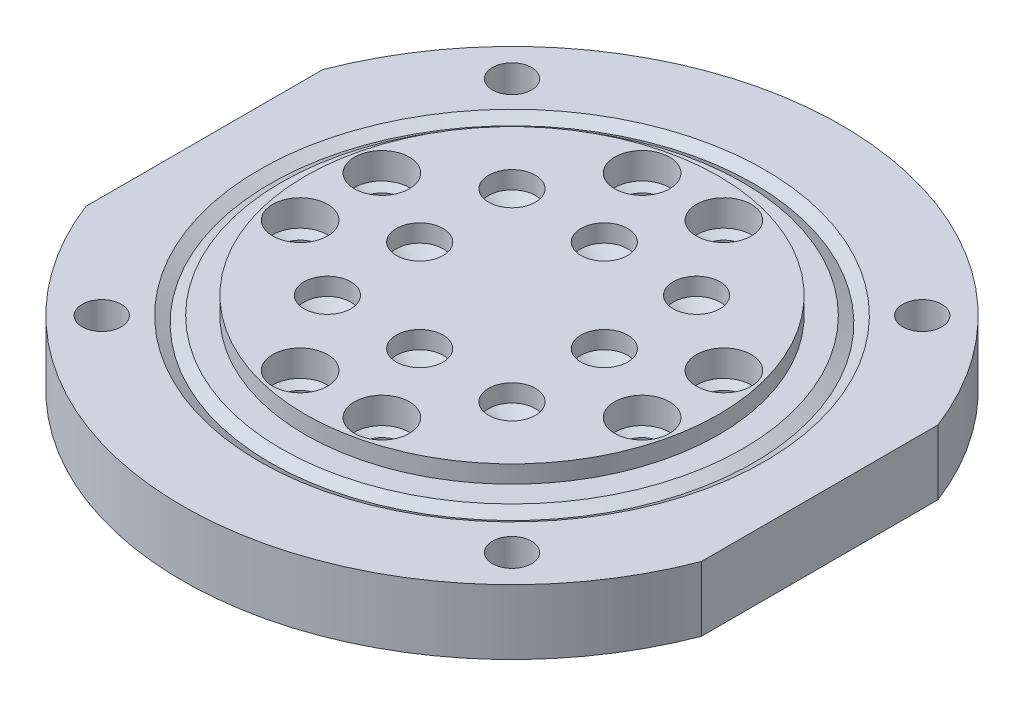
from build123d import *

# Parameters (mm, degrees)
OUTER_R                               = 19.05
BODY_DEPTH                            = 4.7625
F_4_40_TAPPED_HOLE_D                  = 2.2606
SCREW_HOLES_COUNT                     = 4
F_43_0_089_DIAMETER_HOLE1_D           = 2.2606
F_1_8_0_125_DIAMETER_HOLE1_AT_2_COUNT = 2
F_1_8_0_125_DIAMETER_HOLE1_AT_2_PITCH = 19.763158772
F_1_8_0_125_DIAMETER_HOLE2_AT_2_COUNT = 2
F_1_8_0_125_DIAMETER_HOLE2_AT_2_PITCH = 19.763158772
IO_HOLES_PATTERN_COUNT                = 4
INSET_R                               = 19.05
INSET_R_2                             = 11.938
INSET_CUT_DEPTH                       = 1.016
POST_BOTTOMS_COUNT                    = 4
FLAT_CUT_SKETCH_W                     = 2.54
FLAT_CUT_SKETCH_H                     = 38.1
FLAT_CUT_DEPTH                        = 28.358479604


# Read off the part's stored shape, not the designer's step: #36 (0.1065) Diameter Hole1
with BuildPart() as part:
    # outer → Body (new body)
    with BuildSketch(Plane(origin=(0, 0, 0), x_dir=(1, 0, 0), z_dir=(0, 1, 0))):
        with Locations(Location((0, 0, 0), (0, 0, 270))):
            Circle(OUTER_R)
    extrude(amount=-BODY_DEPTH)

    # #4-40 Tapped Hole (through all)
    with Locations(Plane(origin=(0, 0, 0), x_dir=(1, 0, 0), z_dir=(0, 1, 0))):
        with Locations((-11.85393808, 11.85393808)):
            f_4_40_tapped_hole = Hole(F_4_40_TAPPED_HOLE_D / 2)

    # Screw Holes: #4-40 Tapped Hole ×4 about axis
    screw_holes_axis = Axis((0, 0, 0), (0, 1, 0))
    for i in range(1, SCREW_HOLES_COUNT):
        add(f_4_40_tapped_hole.rotate(screw_holes_axis, i * 360 / SCREW_HOLES_COUNT), mode=Mode.SUBTRACT)

    # #43 (0.089) Diameter Hole1 (through all)
    with Locations(Plane(origin=(0, 0, 0), x_dir=(1, 0, 0), z_dir=(0, 1, 0))):
        with Locations((-2.3622, 9.881579386), (-2.3622, -9.881579386)):
            f_43_0_089_diameter_hole1 = Hole(F_43_0_089_DIAMETER_HOLE1_D / 2)

    # Sketch40 → 1/8 (0.125) Diameter Hole1 (revolve, cut)
    with BuildSketch(Plane(origin=(-2.3622, 0, -9.881579386), x_dir=(0, 0, 1), z_dir=(1, 0, 0))):
        Polygon((0, 0), (0, 2.477866233), (1.5875, 1.524), (1.5875, 0), align=None)
    f_1_8_0_125_diameter_hole1 = revolve(axis=Axis((-2.3622, 6.35, -9.881579386), (0, -1, 0)), mode=Mode.SUBTRACT)

    # 1/8 (0.125) Diameter Hole1 at 2: 1/8 (0.125) Diameter Hole1 ×2
    with Locations(*[(0, 0, i * F_1_8_0_125_DIAMETER_HOLE1_AT_2_PITCH) for i in range(1, F_1_8_0_125_DIAMETER_HOLE1_AT_2_COUNT)]):
        add(f_1_8_0_125_diameter_hole1, mode=Mode.SUBTRACT)

    # Sketch42 → 1/8 (0.125) Diameter Hole2 (revolve, cut)
    with BuildSketch(Plane(origin=(-2.3622, -4.7625, -9.881579386), x_dir=(0, 0, -1), z_dir=(1, 0, 0))):
        Polygon((0, 0), (0, 2.477866233), (1.5875, 1.524), (1.5875, 0), align=None)
    f_1_8_0_125_diameter_hole2 = revolve(axis=Axis((-2.3622, -11.1125, -9.881579386), (0, 1, 0)), mode=Mode.SUBTRACT)

    # 1/8 (0.125) Diameter Hole2 at 2: 1/8 (0.125) Diameter Hole2 ×2
    with Locations(*[(0, 0, i * F_1_8_0_125_DIAMETER_HOLE2_AT_2_PITCH) for i in range(1, F_1_8_0_125_DIAMETER_HOLE2_AT_2_COUNT)]):
        add(f_1_8_0_125_diameter_hole2, mode=Mode.SUBTRACT)

    # IO Holes Pattern: #43 (0.089) Diameter Hole1, 1/8 (0.125) Diameter Hole1, 1/8 (0.125) Diameter Hole2 ×4 about axis
    io_holes_pattern_axis = Axis((0, 0, 0), (0, 1, 0))
    add([f_43_0_089_diameter_hole1.rotate(io_holes_pattern_axis, i * 360 / IO_HOLES_PATTERN_COUNT) for i in range(1, IO_HOLES_PATTERN_COUNT)], mode=Mode.SUBTRACT)
    add([f_1_8_0_125_diameter_hole1.rotate(io_holes_pattern_axis, i * 360 / IO_HOLES_PATTERN_COUNT) for i in range(1, IO_HOLES_PATTERN_COUNT)], mode=Mode.SUBTRACT)
    add([f_1_8_0_125_diameter_hole2.rotate(io_holes_pattern_axis, i * 360 / IO_HOLES_PATTERN_COUNT) for i in range(1, IO_HOLES_PATTERN_COUNT)], mode=Mode.SUBTRACT)

    # IO Holes Pattern copy 1 sketch → IO Holes Pattern copy 1 (revolve, cut)
    with BuildSketch(Plane(origin=(9.881579386, 0, 2.3622), x_dir=(1, 0, 0), z_dir=(0, 0, -1))):
        Polygon((0, 0), (0, 2.477866233), (1.5875, 1.524), (1.5875, 0), align=None)
    revolve(axis=Axis((9.881579386, 6.35, 2.3622), (0, -1, 0)), mode=Mode.SUBTRACT)

    # IO Holes Pattern copy 2 sketch → IO Holes Pattern copy 2 (revolve, cut)
    with BuildSketch(Plane(origin=(2.3622, 0, -9.881579386), x_dir=(0, 0, -1), z_dir=(-1, 0, 0))):
        Polygon((0, 0), (0, 2.477866233), (1.5875, 1.524), (1.5875, 0), align=None)
    revolve(axis=Axis((2.3622, 6.35, -9.881579386), (0, -1, 0)), mode=Mode.SUBTRACT)

    # IO Holes Pattern copy 3 sketch → IO Holes Pattern copy 3 (revolve, cut)
    with BuildSketch(Plane(origin=(-9.881579386, 0, -2.3622), x_dir=(-1, 0, 0), z_dir=(0, 0, 1))):
        Polygon((0, 0), (0, 2.477866233), (1.5875, 1.524), (1.5875, 0), align=None)
    revolve(axis=Axis((-9.881579386, 6.35, -2.3622), (0, -1, 0)), mode=Mode.SUBTRACT)

    # IO Holes Pattern copy 4 sketch → IO Holes Pattern copy 4 (revolve, cut)
    with BuildSketch(Plane(origin=(9.881579386, -4.7625, 2.3622), x_dir=(-1, 0, 0), z_dir=(0, 0, -1))):
        Polygon((0, 0), (0, 2.477866233), (1.5875, 1.524), (1.5875, 0), align=None)
    revolve(axis=Axis((9.881579386, -11.1125, 2.3622), (0, 1, 0)), mode=Mode.SUBTRACT)

    # IO Holes Pattern copy 5 sketch → IO Holes Pattern copy 5 (revolve, cut)
    with BuildSketch(Plane(origin=(2.3622, -4.7625, -9.881579386), x_dir=(0, 0, 1), z_dir=(-1, 0, 0))):
        Polygon((0, 0), (0, 2.477866233), (1.5875, 1.524), (1.5875, 0), align=None)
    revolve(axis=Axis((2.3622, -11.1125, -9.881579386), (0, 1, 0)), mode=Mode.SUBTRACT)

    # IO Holes Pattern copy 6 sketch → IO Holes Pattern copy 6 (revolve, cut)
    with BuildSketch(Plane(origin=(-9.881579386, -4.7625, -2.3622), x_dir=(1, 0, 0), z_dir=(0, 0, 1))):
        Polygon((0, 0), (0, 2.477866233), (1.5875, 1.524), (1.5875, 0), align=None)
    revolve(axis=Axis((-9.881579386, -11.1125, -2.3622), (0, 1, 0)), mode=Mode.SUBTRACT)

    # Inset → Inset Cut (cut)
    with BuildSketch(Plane(origin=(0, 0, 0), x_dir=(1, 0, 0), z_dir=(0, 1, 0))):
        with Locations(Location((0, 0, 0), (0, 0, 270))):
            Circle(INSET_R)
        with Locations(Location((0, 0, 0), (0, 0, 270))):
            Circle(INSET_R_2, mode=Mode.SUBTRACT)
    extrude(amount=-INSET_CUT_DEPTH, mode=Mode.SUBTRACT)

    # #36 (0.1065) Diameter Hole1 outline → #36 (0.1065) Diameter Hole1 (revolve, cut)
    with BuildSketch(Plane(origin=(-5.334, 0, -5.334), x_dir=(1, 0, 0), z_dir=(0, 0, 1))):
        Polygon((0, 0), (0, -1.82869403), (1.35255, -1.016), (1.35255, 0), align=None)
    f_36_0_1065_diameter_hole1 = revolve(axis=Axis((-5.334, 0, -5.334), (0, 1, 0)), mode=Mode.SUBTRACT)

    # 36 _0.1065_ Diameter Hole1 2 outline → 36 _0.1065_ Diameter Hole1 2 (revolve, cut)
    with BuildSketch(Plane.XY.offset(-5.334)):
        Polygon((0, 0), (0, -1.82869403), (1.35255, -1.016), (1.35255, 0), align=None)
    f_36_0_1065_diameter_hole1_2 = revolve(axis=Axis((0, 0, -5.334), (0, 1, 0)), mode=Mode.SUBTRACT)

    # Post Bottoms: #36 (0.1065) Diameter Hole1, 36 _0.1065_ Diameter Hole1 2 ×4 about axis
    post_bottoms_axis = Axis((0, 0, 0), (0, 1, 0))
    add([f_36_0_1065_diameter_hole1.rotate(post_bottoms_axis, i * 360 / POST_BOTTOMS_COUNT) for i in range(1, POST_BOTTOMS_COUNT)], mode=Mode.SUBTRACT)
    add([f_36_0_1065_diameter_hole1_2.rotate(post_bottoms_axis, i * 360 / POST_BOTTOMS_COUNT) for i in range(1, POST_BOTTOMS_COUNT)], mode=Mode.SUBTRACT)

    # v_sketch → V cut (revolve, cut)
    with BuildSketch(Plane.XY, mode=Mode.PRIVATE) as v_cut_sk:
        Polygon((-13.97, -1.397), (-13.335909517, -1.016), (-14.604090483, -1.016), align=None)
    revolve(v_cut_sk.sketch.rotate(Axis((0, 0.15875, 0), (0, -1, 0)), 270), axis=Axis((0, 0.15875, 0), (0, -1, 0)), mode=Mode.SUBTRACT)

    # Flat Cut Sketch → Flat Cut (cut, through all)
    with BuildSketch(Plane(origin=(0, 0, 0), x_dir=(1, 0, 0), z_dir=(0, 1, 0))):
        with Locations((19.05, 0)):
            Rectangle(FLAT_CUT_SKETCH_W, FLAT_CUT_SKETCH_H)
        with Locations((-19.05, 0)):
            Rectangle(FLAT_CUT_SKETCH_W, FLAT_CUT_SKETCH_H)
    extrude(amount=-FLAT_CUT_DEPTH, mode=Mode.SUBTRACT)


solid = part.part
